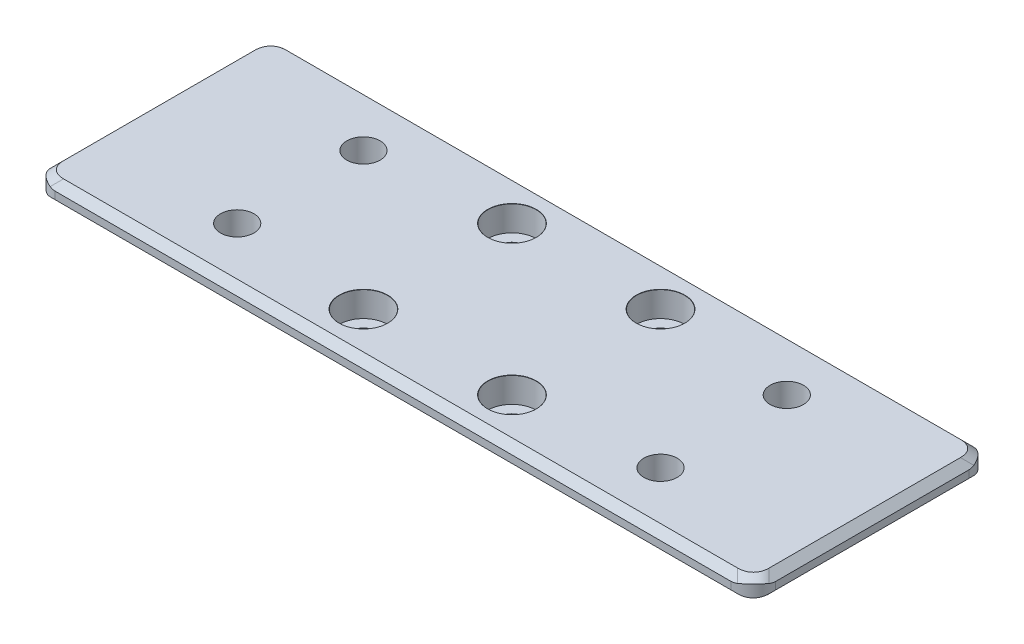
from build123d import *

# Parameters (mm, degrees)
SKETCH1_W                                    = 97
SKETCH1_H                                    = 32
BOSS_EXTRUDE1_DEPTH                          = 5
HOLE1_D                                      = 4.5
HOLE1_DEPTH                                  = 6
CHAMFER1_SIZE                                = 1
CHAMFER2_SIZE                                = 3
FILLET1_R                                    = 3
CBORE_FOR_M3_HEX_SOCKET_HEAD_CAP_SCR_2_COUNT = 2
CBORE_FOR_M3_HEX_SOCKET_HEAD_CAP_SCR_2_PITCH = 20
CBORE_FOR_M3_HEX_SOCKET_HEAD_CAP_SCR_3_COUNT = 2
CBORE_FOR_M3_HEX_SOCKET_HEAD_CAP_SCR_3_PITCH = 20
CBORE_FOR_M3_HEX_SOCKET_HEAD_CAP_SCR_4_COUNT = 2
CBORE_FOR_M3_HEX_SOCKET_HEAD_CAP_SCR_4_PITCH = 28.284271247


with BuildPart() as part:
    # Sketch1 → Boss-Extrude1 (new body)
    with BuildSketch(Plane(origin=(0, 0, 0), x_dir=(1, 0, 0), z_dir=(0, 1, 0))):
        Rectangle(SKETCH1_W, SKETCH1_H)
    extrude(amount=BOSS_EXTRUDE1_DEPTH)

    # Hole1
    with Locations(Plane(origin=(0, 5, 0), x_dir=(1, 0, 0), z_dir=(0, 1, 0))):
        with Locations((-28.5, 8.5), (-28.5, -8.5), (28.5, -8.5), (28.5, 8.5)):
            Hole(HOLE1_D / 2, depth=HOLE1_DEPTH)

    # Chamfer1
    chamfer1_edges = [part.edges().sort_by_distance(p)[0] for p in [
        (-48.5, 5, 0),
        (0, 5, 16),
        (48.5, 5, 0),
        (0, 5, -16),
    ]]
    chamfer(chamfer1_edges, length=CHAMFER1_SIZE)

    # Chamfer2
    chamfer2_edges = [part.edges().sort_by_distance(p)[0] for p in [
        (0, 0, 16),
        (-48.5, 0, 0),
        (0, 0, -16),
        (48.5, 0, 0),
    ]]
    chamfer(chamfer2_edges, length=CHAMFER2_SIZE)

    # Fillet1
    # the kernel refuses this fillet: 3 mm, written as the material it takes off along each edge
    with BuildSketch(Plane(origin=(48.5, -4.5, 16), x_dir=(0, 0, -1), z_dir=(0, 1, 0)), Plane(origin=(48.5, -4.5, -16), x_dir=(-1, 0, 0), z_dir=(0, 1, 0))) as fillet1_piece_1:
        with BuildLine():
            CenterArc((FILLET1_R, FILLET1_R), FILLET1_R, 180, 90)
            Line((0, FILLET1_R), (0, 0))
            Line((0, 0), (FILLET1_R, 0))
        make_face()
    extrude(amount=16, mode=Mode.SUBTRACT)
    with BuildSketch(Plane(origin=(-48.5, -4.5, 16), x_dir=(0, 0, -1), z_dir=(0, 1, 0)), Plane(origin=(-48.5, -4.5, -16), x_dir=(1, 0, 0), z_dir=(0, 1, 0))) as fillet1_piece_2:
        with BuildLine():
            CenterArc((FILLET1_R, -FILLET1_R), FILLET1_R, 90, 90)
            Line((0, -FILLET1_R), (0, 0))
            Line((0, 0), (FILLET1_R, 0))
        make_face()
    extrude(amount=16, mode=Mode.SUBTRACT)
    with BuildSketch(Plane(origin=(-51, 1.5, -18.5), x_dir=(0.8164965809277261, -0.40824829046386363, -0.40824829046386235), z_dir=(0.5773502691896258, 0.5773502691896258, 0.5773502691896258)), Plane(origin=(-51, 1.5, 18.5), x_dir=(-0.4082482904638625, -0.4082482904638635, -0.8164965809277259), z_dir=(0.5773502691896258, 0.5773502691896258, -0.5773502691896258)), Plane(origin=(45, 7.5, 12.5), x_dir=(0.40824829046386274, -0.40824829046386324, -0.816496580927726), z_dir=(0.5773502691896258, -0.5773502691896258, 0.5773502691896258))) as fillet1_piece_3:
        with BuildLine():
            CenterArc((FILLET1_R * 0.57735026919, -FILLET1_R), FILLET1_R, 90, 60)
            Line((-FILLET1_R * 0.288675134595, -FILLET1_R * 0.5), (0, 0))
            Line((0, 0), (FILLET1_R * 0.57735026919, 0))
        make_face()
    extrude(amount=10.392304845, mode=Mode.SUBTRACT)
    with BuildSketch(Plane(origin=(51, 1.5, -18.5), x_dir=(-0.816496580927726, -0.4082482904638631, -0.40824829046386285), z_dir=(-0.5773502691896258, 0.5773502691896258, 0.5773502691896258))) as fillet1_piece_4:
        with BuildLine():
            CenterArc((FILLET1_R * 0.57735026919, FILLET1_R), FILLET1_R, 210, 60)
            Line((-FILLET1_R * 0.288675134595, FILLET1_R * 0.5), (0, 0))
            Line((0, 0), (FILLET1_R * 0.57735026919, 0))
        make_face()
    extrude(amount=10.392304845, mode=Mode.SUBTRACT)
    with BuildSketch(Plane(origin=(-43, -2.5, 10.5), x_dir=(-0.4082482904638623, 0.4082482904638638, -0.816496580927726), z_dir=(-0.5773502691896258, 0.5773502691896258, 0.5773502691896258)), Plane(origin=(51, 5.5, -18.5), x_dir=(-0.816496580927726, 0.40824829046386324, -0.40824829046386274), z_dir=(-0.5773502691896258, -0.5773502691896258, 0.5773502691896258))) as fillet1_piece_5:
        with BuildLine():
            CenterArc((FILLET1_R * 0.57735026919, -FILLET1_R), FILLET1_R, 90, 60)
            Line((-FILLET1_R * 0.288675134595, -FILLET1_R * 0.5), (0, 0))
            Line((0, 0), (FILLET1_R * 0.57735026919, 0))
        make_face()
    extrude(amount=13.856406461, mode=Mode.SUBTRACT)
    with BuildSketch(Plane(origin=(-51, 5.5, -18.5), x_dir=(0.816496580927726, 0.4082482904638625, -0.4082482904638635), z_dir=(0.5773502691896258, -0.5773502691896258, 0.5773502691896258)), Plane(origin=(43, -2.5, 10.5), x_dir=(0.40824829046386285, 0.40824829046386313, -0.816496580927726), z_dir=(0.5773502691896258, 0.5773502691896258, 0.5773502691896258))) as fillet1_piece_6:
        with BuildLine():
            CenterArc((FILLET1_R * 0.57735026919, FILLET1_R), FILLET1_R, 210, 60)
            Line((-FILLET1_R * 0.288675134595, FILLET1_R * 0.5), (0, 0))
            Line((0, 0), (FILLET1_R * 0.57735026919, 0))
        make_face()
    extrude(amount=13.856406461, mode=Mode.SUBTRACT)

    # Sketch7 → CBORE for M3 Hex Socket Head Cap Screw1 (revolve, cut)
    with BuildSketch(Plane(origin=(10, 5, -10), x_dir=(0, 0, 1), z_dir=(1, 0, 0))):
        Polygon((0, 0), (0, 5), (1.7, 5), (1.7, 3.4), (3.25, 3.4), (3.25, 0.025), (3.275, 0), align=None)
    cbore_for_m3_hex_socket_head_cap_screw1 = revolve(axis=Axis((10, 11.35, -10), (0, -1, 0)), mode=Mode.SUBTRACT)

    # CBORE for M3 Hex Socket Head Cap Scr 2: CBORE for M3 Hex Socket Head Cap Screw1 ×2
    with Locations(*[(-i * CBORE_FOR_M3_HEX_SOCKET_HEAD_CAP_SCR_2_PITCH, 0, 0) for i in range(1, CBORE_FOR_M3_HEX_SOCKET_HEAD_CAP_SCR_2_COUNT)]):
        add(cbore_for_m3_hex_socket_head_cap_screw1, mode=Mode.SUBTRACT)

    # CBORE for M3 Hex Socket Head Cap Scr 3: CBORE for M3 Hex Socket Head Cap Screw1 ×2
    with Locations(*[(0, 0, i * CBORE_FOR_M3_HEX_SOCKET_HEAD_CAP_SCR_3_PITCH) for i in range(1, CBORE_FOR_M3_HEX_SOCKET_HEAD_CAP_SCR_3_COUNT)]):
        add(cbore_for_m3_hex_socket_head_cap_screw1, mode=Mode.SUBTRACT)

    # CBORE for M3 Hex Socket Head Cap Scr 4: CBORE for M3 Hex Socket Head Cap Screw1 ×2
    with Locations(*[Vector(-0.7071067811865475, 0, 0.7071067811865477) * (i * CBORE_FOR_M3_HEX_SOCKET_HEAD_CAP_SCR_4_PITCH) for i in range(1, CBORE_FOR_M3_HEX_SOCKET_HEAD_CAP_SCR_4_COUNT)]):
        add(cbore_for_m3_hex_socket_head_cap_screw1, mode=Mode.SUBTRACT)


solid = part.part
